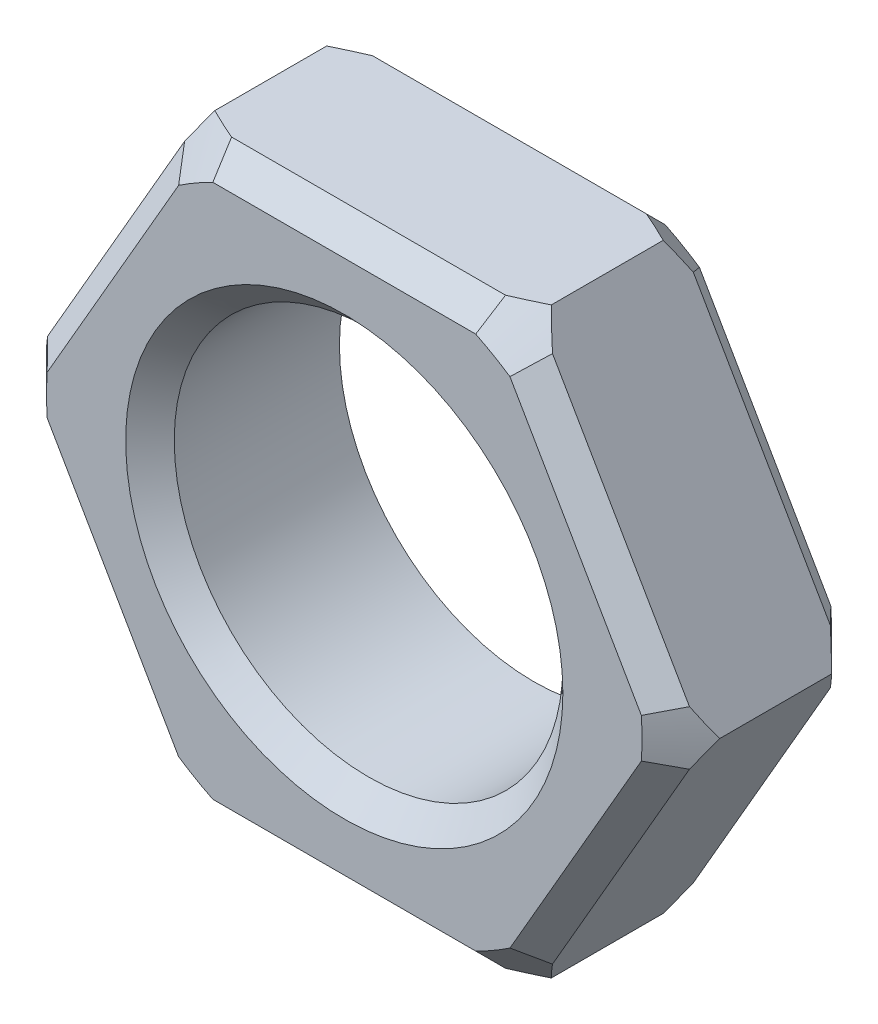
from build123d import *

# Parameters (mm, degrees)
SKETCH_1_R      = 8
EXTRUDE_1_DEPTH = 7.8
CHAMFER_1_SIZE  = 1


with BuildPart() as part:
    # Эскиз1 → Бобышка-Вытянуть1 (new body)
    with BuildSketch(Plane.XY):
        Polygon((-6.92820323, -12), (6.92820323, -12), (13.856406461, 0), (6.92820323, 12), (-6.92820323, 12), (-13.856406461, 0), align=None)
        Circle(SKETCH_1_R, mode=Mode.SUBTRACT)
    extrude(amount=EXTRUDE_1_DEPTH)

    # Фаска1
    chamfer_1_edges = [part.edges().sort_by_distance(p)[0] for p in [
        (0, -12, 0),
        (10.392304845, -6, 0),
        (10.392304845, 6, 0),
        (0, 12, 0),
        (-10.392304845, 6, 0),
        (-10.392304845, -6, 0),
        (-8, 0, 7.8),
        (-10.392304845, 6, 7.8),
        (0, 12, 7.8),
        (10.392304845, 6, 7.8),
        (10.392304845, -6, 7.8),
        (0, -12, 7.8),
        (-10.392304845, -6, 7.8),
    ]]
    chamfer(chamfer_1_edges, length=CHAMFER_1_SIZE)

    # Эскиз2 → Вырез-Повернуть1 (revolve, cut)
    with BuildSketch(Plane(origin=(0, 0, 0), x_dir=(1, 0, 0), z_dir=(0, 1, 0))):
        Polygon((-11.362693449, 0.896430395), (-14.259123844, -2), (-14.259123844, -5.8), (-11.615276994, -8.44384685), (-16.698807892, -8.44384685), (-16.698807892, 0.896430395), align=None)
    revolve(axis=Axis((0, 0, -2.189920654), (0, 0, 1)), mode=Mode.SUBTRACT)


solid = part.part
